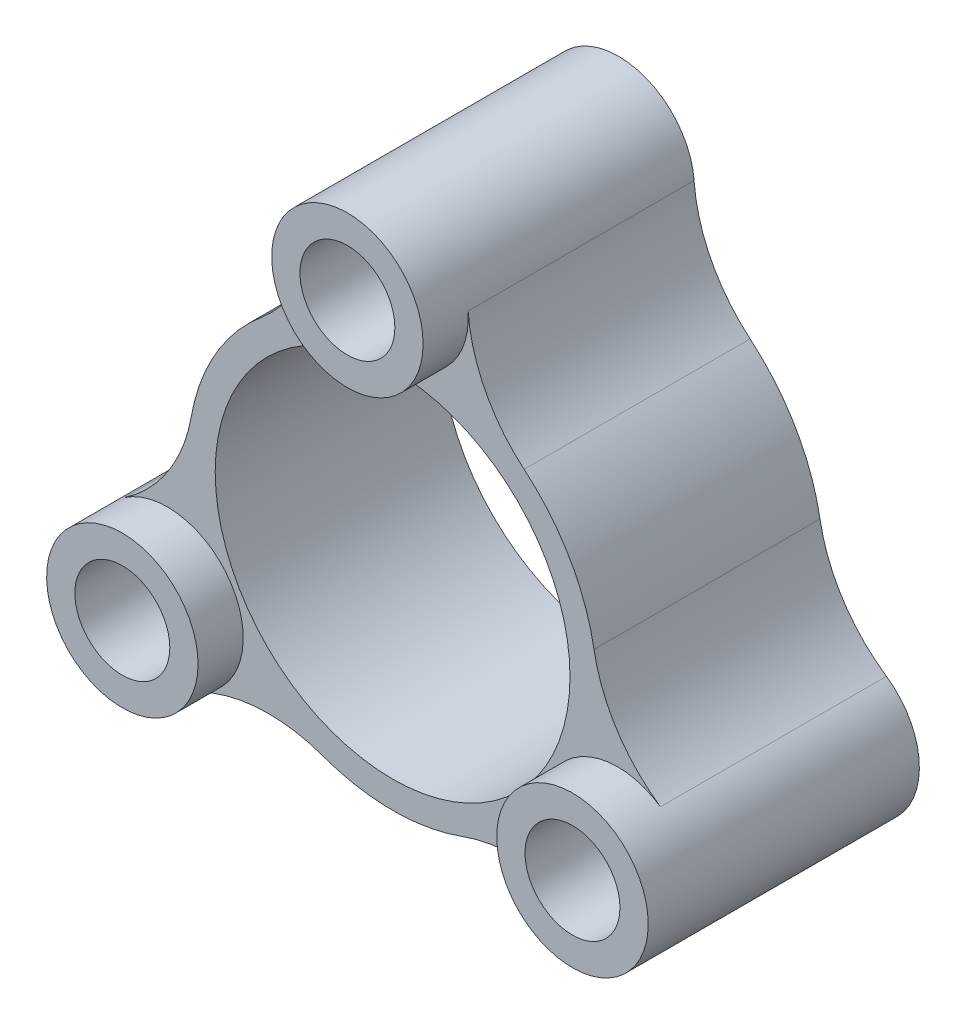
from build123d import *

# Parameters (mm, degrees)
SKETCH1_R           = 7.85
SKETCH1_R_2         = 2.1
BOSS_EXTRUDE1_DEPTH = 10
SKETCH4_R           = 3.35
SKETCH4_R_2         = 2.1
BOSS_EXTRUDE3_DEPTH = 2


with BuildPart() as part:
    # Sketch1 → Boss-Extrude1 (new body)
    with BuildSketch(Plane.XY):
        with BuildLine():
            ThreePointArc((8.912143686, 1.573592996), (7.837529904, 4.525), (5.818843353, 6.931346336))
            ThreePointArc((5.818843353, 6.931346336), (4.093096628, 9.094081073), (3.340162383, 11.756544844))
            ThreePointArc((3.340162383, 11.756544844), (0, 14.85), (-3.340162383, 11.756544844))
            ThreePointArc((-3.340162383, 11.756544844), (-4.093096628, 9.094081073), (-5.818843353, 6.931346336))
            ThreePointArc((-5.818843353, 6.931346336), (-7.837529904, 4.525), (-8.912143686, 1.573592996))
            ThreePointArc((-8.912143686, 1.573592996), (-9.922253548, -1.002314877), (-11.851547687, -2.985606946))
            ThreePointArc((-11.851547687, -2.985606946), (-12.860477246, -7.425), (-8.511385304, -8.770937898))
            ThreePointArc((-8.511385304, -8.770937898), (-5.82915692, -8.091766197), (-3.093300333, -8.504939333))
            ThreePointArc((-3.093300333, -8.504939333), (0, -9.05), (3.093300333, -8.504939333))
            ThreePointArc((3.093300333, -8.504939333), (5.82915692, -8.091766197), (8.511385304, -8.770937898))
            ThreePointArc((8.511385304, -8.770937898), (12.860477246, -7.425), (11.851547687, -2.985606946))
            ThreePointArc((11.851547687, -2.985606946), (9.922253548, -1.002314877), (8.912143686, 1.573592996))
        make_face()
        Circle(SKETCH1_R, mode=Mode.SUBTRACT)
        with Locations((9.959292144, -5.75)):
            Circle(SKETCH1_R_2, mode=Mode.SUBTRACT)
        with Locations((0, 11.5)):
            Circle(SKETCH1_R_2, mode=Mode.SUBTRACT)
        with Locations((-9.959292144, -5.75)):
            Circle(SKETCH1_R_2, mode=Mode.SUBTRACT)
    extrude(amount=BOSS_EXTRUDE1_DEPTH)

    # Sketch4 → Boss-Extrude3 (add)
    # profile 1 of 3: a face of its own
    with BuildSketch(Plane.XY.offset(10)):
        with Locations((-9.959292144, -5.75)):
            Circle(SKETCH4_R)
        with Locations((-9.959292144, -5.75)):
            Circle(SKETCH4_R_2, mode=Mode.SUBTRACT)
    # profile 2 of 3: a face of its own
    with BuildSketch(Plane.XY.offset(10)):
        with Locations((0, 11.5)):
            Circle(SKETCH4_R)
        with Locations((0, 11.5)):
            Circle(SKETCH4_R_2, mode=Mode.SUBTRACT)
    # profile 3 of 3: a face of its own
    with BuildSketch(Plane.XY.offset(10)):
        with Locations((9.959292144, -5.75)):
            Circle(SKETCH4_R)
        with Locations((9.959292144, -5.75)):
            Circle(SKETCH4_R_2, mode=Mode.SUBTRACT)
    extrude(amount=BOSS_EXTRUDE3_DEPTH)


solid = part.part
